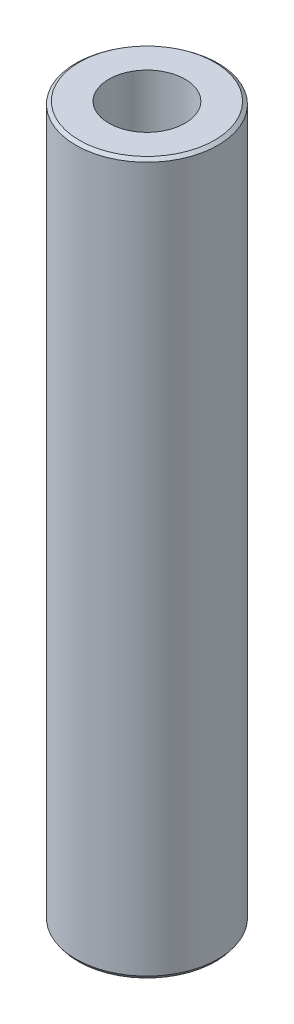
from build123d import *
from OCP.BRepFilletAPI import BRepFilletAPI_MakeChamfer

# Parameters (mm, degrees)
SKETCH1_R           = 60
BOSS_EXTRUDE1_DEPTH = 600
SKETCH2_R           = 32.189266056
CUT_EXTRUDE1_DEPTH  = 606.970296302
CHAMFER1_SIZE       = 2.201351631
CHAMFER1_SIZE2      = 2.92752835


with BuildPart() as part:
    # Sketch1 → Boss-Extrude1 (new body)
    with BuildSketch(Plane(origin=(0, 0, 0), x_dir=(1, 0, 0), z_dir=(0, 1, 0))):
        Circle(SKETCH1_R)
    extrude(amount=BOSS_EXTRUDE1_DEPTH)

    # Sketch2 → Cut-Extrude1 (cut, through all)
    with BuildSketch(Plane(origin=(0, 0, 0), x_dir=(1, 0, 0), z_dir=(0, 1, 0))):
        Circle(SKETCH2_R)
    extrude(amount=CUT_EXTRUDE1_DEPTH, mode=Mode.SUBTRACT)

    # Chamfer1: one chamfer whose edges measure the first distance from different faces: ONE call of the kernel's chamfer builder (chamfer() names one face for all edges)
    chamfer1_edges_1 = [part.edges().sort_by_distance(p)[0] for p in [
        (-60, 600, 0),
    ]]
    chamfer1_side_1 = [part.faces().sort_by_distance(p)[0] for p in [
        (-60, 300, 0),
    ]]
    chamfer1_edges_2 = [part.edges().sort_by_distance(p)[0] for p in [
        (-60, 0, 0),
    ]]
    chamfer1_side_2 = [part.faces().sort_by_distance(p)[0] for p in [
        (-58.302943725, 0, 0),
    ]]
    chamfer1 = BRepFilletAPI_MakeChamfer(part.part.solid().wrapped)
    for e in chamfer1_edges_1:
        chamfer1.Add(CHAMFER1_SIZE, CHAMFER1_SIZE2, e.wrapped, chamfer1_side_1[0].wrapped)  # the first distance lies on this face
    for e in chamfer1_edges_2:
        chamfer1.Add(CHAMFER1_SIZE, CHAMFER1_SIZE2, e.wrapped, chamfer1_side_2[0].wrapped)  # the first distance lies on this face
    add(Compound.cast(chamfer1.Shape()), mode=Mode.REPLACE)


solid = part.part
